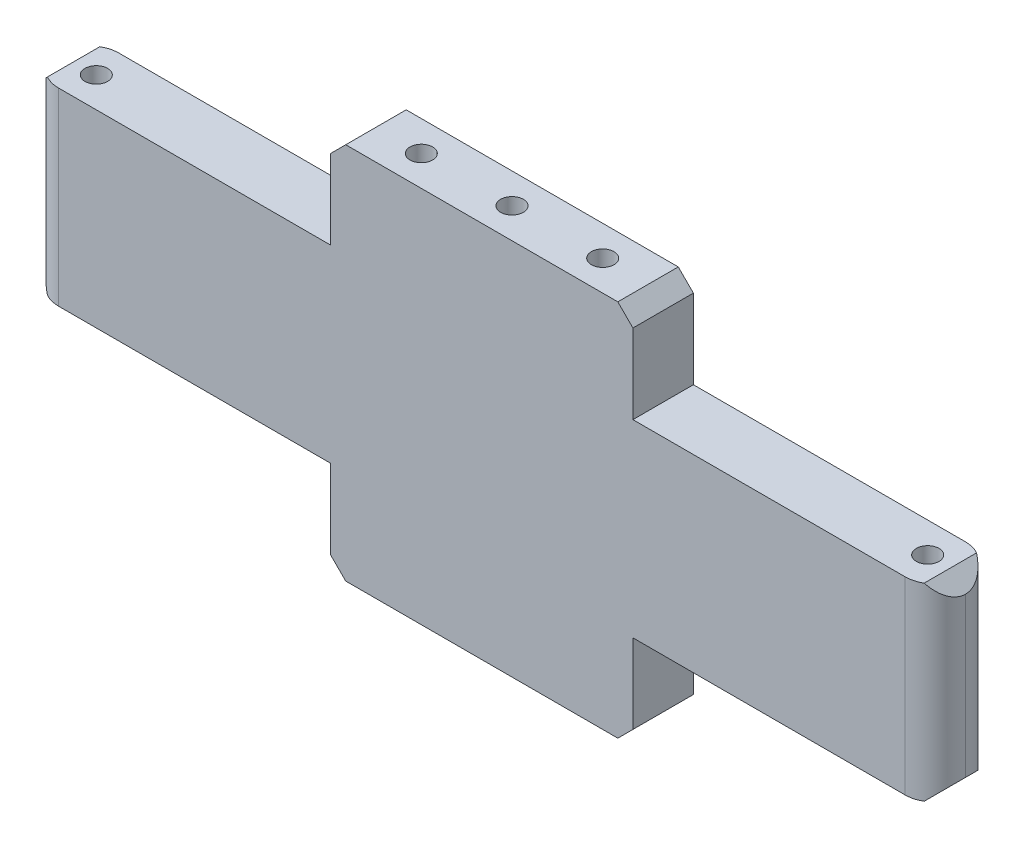
from build123d import *

# Parameters (mm, degrees)
EXTRUDE_1_DEPTH     = 8
CHAMFER_1_SIZE      = 2
SKETCH_4_R          = 1.5
CUT_EXTRUDE_3_DEPTH = 50
CHAMFER_3_SIZE      = 2
FILLET_1_R          = 4
SKETCH_6_R          = 1.5
CUT_EXTRUDE_5_DEPTH = 72.205687975


with BuildPart() as part:
    # 草图1 → 凸台-拉伸1 (new body)
    with BuildSketch(Plane.XY):
        Polygon((-20, 25), (20, 25), (20, 12.5), (60, 12.5), (60, -12.5), (20, -12.5), (20, -25), (-20, -25), (-20, -12.5), (-60, -12.5), (-60, 12.5), (-20, 12.5), align=None)
    extrude(amount=EXTRUDE_1_DEPTH)

    # 倒角1
    chamfer_1_edges = [part.edges().sort_by_distance(p)[0] for p in [
        (20, -25, 4),
        (-20, -25, 4),
        (-20, 25, 4),
        (20, 25, 4),
    ]]
    chamfer(chamfer_1_edges, length=CHAMFER_1_SIZE)

    # 草图4 → 切除-拉伸3 (cut)
    with BuildSketch(Plane(origin=(0, 25, 0), x_dir=(1, 0, 0), z_dir=(0, 1, 0))):
        with Locations(Location((-12, -4, 0), (0, 0, 270))):
            Circle(SKETCH_4_R)
        with Locations(Location((0, -4, 0), (0, 0, 270))):
            Circle(SKETCH_4_R)
        with Locations(Location((12, -4, 0), (0, 0, 270))):
            Circle(SKETCH_4_R)
    extrude(amount=-CUT_EXTRUDE_3_DEPTH, mode=Mode.SUBTRACT)

    # 倒角3
    chamfer_3_edges = [part.edges().sort_by_distance(p)[0] for p in [
        (-60, -12.5, 4),
        (-60, 12.5, 4),
        (60, 12.5, 4),
        (60, -12.5, 4),
    ]]
    chamfer(chamfer_3_edges, length=CHAMFER_3_SIZE)

    # 圆角1
    fillet_1_edges = [part.edges().sort_by_distance(p)[0] for p in [
        (60, 0, 0),
        (60, 0, 8),
        (-60, 0, 0),
        (-60, 0, 8),
    ]]
    fillet(fillet_1_edges, radius=FILLET_1_R - 0.0001)  # a hair under: the kernel refuses the full size

    # 草图6 → 切除-拉伸5 (cut, through all)
    with BuildSketch(Plane(origin=(0, 12.5, 0), x_dir=(1, 0, 0), z_dir=(0, 1, 0))):
        with Locations(Location((55, -4, 0), (0, 0, 180))):
            Circle(SKETCH_6_R)
    cut_extrude_5 = extrude(amount=-CUT_EXTRUDE_5_DEPTH, mode=Mode.SUBTRACT)

    # 镜向4: 切除-拉伸5 across plane
    add(cut_extrude_5.mirror(Plane(origin=(0, 0, 0), x_dir=(0, 0, 1), z_dir=(1, 0, 0))), mode=Mode.SUBTRACT)


solid = part.part
